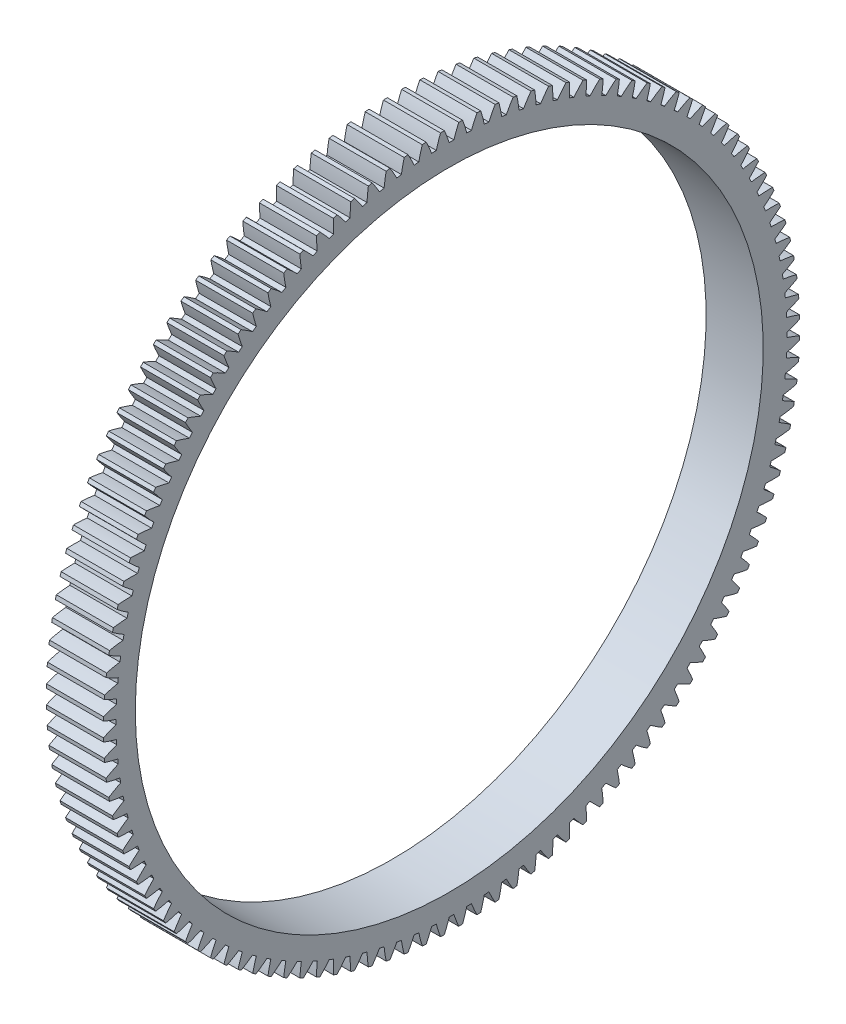
from build123d import *

# Parameters (mm, degrees)
BASPROSKE_W        = 12
BASPROSKE_H        = 61
TOOTHCUT_DEPTH     = 88.097646352
TEETHCUTS_COUNT    = 120
TEETHCUTS_ANGLE    = 357
BORSKE_R           = 0.4
BORE_DEPTH         = 50.0000508
SKETCH1_R          = 55
CUT_EXTRUDE1_DEPTH = 10
CUT_EXTRUDE2_DEPTH = 2


with BuildPart() as part:
    # BasProSke → Base-Revolve (revolve)
    with BuildSketch(Plane(origin=(0, 0, 0), x_dir=(1, 0, 0), z_dir=(0, 1, 0)), mode=Mode.PRIVATE) as base_revolve_sk:
        with Locations((6, 30.5)):
            Rectangle(BASPROSKE_W, BASPROSKE_H)
    revolve(base_revolve_sk.sketch.rotate(Axis((-10, 0, 0), (1, 0, 0)), 180), axis=Axis((-10, 0, 0), (1, 0, 0)))

    # TooCutSke → ToothCut (cut, through all)
    with BuildSketch(Plane(origin=(0, 0, 0), x_dir=(0, 0, -1), z_dir=(1, 0, 0))):
        with BuildLine():
            ThreePointArc((0.410713273, 58.747564338), (0, 58.749), (-0.410713273, 58.747564338))
            ThreePointArc((-0.410713273, 58.747564338), (-0.812377908, 59.890725701), (-1.271226346, 61.01215804))
            ThreePointArc((-1.271226346, 61.01215804), (0, 61.0254), (1.271226346, 61.01215804))
            ThreePointArc((1.271226346, 61.01215804), (0.812377908, 59.890725701), (0.410713273, 58.747564338))
        make_face()
    toothcut = extrude(amount=TOOTHCUT_DEPTH, mode=Mode.SUBTRACT)

    # TeethCuts: ToothCut ×120 about axis
    teethcuts_axis = Axis((-10, 0, 0), (1, 0, 0))
    for i in range(1, TEETHCUTS_COUNT):
        add(toothcut.rotate(teethcuts_axis, i * TEETHCUTS_ANGLE / (TEETHCUTS_COUNT - 1)), mode=Mode.SUBTRACT)

    # BorSke → Bore (cut, symmetric)
    with BuildSketch(Plane(origin=(0, 0, 0), x_dir=(0, 0, -1), z_dir=(1, 0, 0))):
        with Locations(Location((0, 0, 0), (0, 0, 180))):
            Circle(BORSKE_R)
    extrude(amount=BORE_DEPTH, both=True, mode=Mode.SUBTRACT)

    # Sketch1 → Cut-Extrude1 (cut)
    with BuildSketch(Plane.ZY):
        with Locations((0.4, 0)):
            Circle(SKETCH1_R)
    extrude(amount=-CUT_EXTRUDE1_DEPTH, mode=Mode.SUBTRACT)

    # Sketch2 → Cut-Extrude2 (cut)
    with BuildSketch(Plane(origin=(12, 0, 0), x_dir=(0, 0, -1), z_dir=(1, 0, 0))):
        with BuildLine():
            ThreePointArc((-60.986981523, 1.260192324), (-59.877876436, 0.807499581), (-58.747564338, 0.410713273))
            ThreePointArc((-58.747564338, 0.410713273), (-58.749, 0), (-58.747564338, -0.410713273))
            ThreePointArc((-58.747564338, -0.410713273), (-59.877876436, -0.807499581), (-60.986981523, -1.260192324))
            ThreePointArc((-60.986981523, -1.260192324), (-60.979096824, -1.596793847), (-60.969354355, -1.933346722))
            ThreePointArc((-60.969354355, -1.933346722), (-59.83807715, -2.32737299), (-58.688547914, -2.664459552))
            ThreePointArc((-58.688547914, -2.664459552), (-58.668486537, -3.074685093), (-58.645557771, -3.484760361))
            ThreePointArc((-58.645557771, -3.484760361), (-59.753554624, -3.940158852), (-60.837447614, -4.450277271))
            ThreePointArc((-60.837447614, -4.450277271), (-60.811957358, -4.786004839), (-60.784614424, -5.121586599))
            ThreePointArc((-60.784614424, -5.121586599), (-59.634265854, -5.455866393), (-58.468670261, -5.732329279))
            ThreePointArc((-58.468670261, -5.732329279), (-58.427166831, -6.140942689), (-58.382807806, -6.549255963))
            ThreePointArc((-58.382807806, -6.549255963), (-59.465452473, -7.062018422), (-60.52116249, -7.628164317))
            ThreePointArc((-60.52116249, -7.628164317), (-60.478136544, -7.962097725), (-60.433268091, -8.295788563))
            ThreePointArc((-60.433268091, -8.295788563), (-59.26700118, -8.569405646), (-58.088534046, -8.784487089))
            ThreePointArc((-58.088534046, -8.784487089), (-58.025702322, -9.190368387), (-57.960034624, -9.59580051))
            ThreePointArc((-57.960034624, -9.59580051), (-59.01435965, -10.16452149), (-60.038993066, -10.785143095))
            ThreePointArc((-60.038993066, -10.785143095), (-59.978549361, -11.116367055), (-59.91627837, -11.447252348))
            ThreePointArc((-59.91627837, -11.447252348), (-58.737289776, -11.659456754), (-57.549181197, -11.812567231))
            ThreePointArc((-57.549181197, -11.812567231), (-57.465193396, -12.214603924), (-57.378397015, -12.616043635))
            ThreePointArc((-57.378397015, -12.616043635), (-58.401512569, -13.239164311), (-59.392260936, -13.912560545))
            ThreePointArc((-59.392260936, -13.912560545), (-59.314565144, -14.240167195), (-59.235062295, -14.567340009))
            ThreePointArc((-59.235062295, -14.567340009), (-58.046583543, -14.717550101), (-56.852090042, -14.808269947))
            ThreePointArc((-56.852090042, -14.808269947), (-56.747176369, -15.205360081), (-56.639489208, -15.601707061))
            ThreePointArc((-56.639489208, -15.601707061), (-57.628591002, -16.277519502), (-58.582738747, -17.001844634))
            ThreePointArc((-58.582738747, -17.001844634), (-58.488003827, -17.324936027), (-58.391487031, -17.647499604))
            ThreePointArc((-58.391487031, -17.647499604), (-57.19677566, -17.735303667), (-55.999171261, -17.763384224))
            ThreePointArc((-55.999171261, -17.763384224), (-55.873619276, -18.154439403), (-55.745336499, -18.544607293))
            ThreePointArc((-55.745336499, -18.544607293), (-56.697713473, -19.271259145), (-57.612645342, -20.044527848))
            ThreePointArc((-57.612645342, -20.044527848), (-57.501130957, -20.362218413), (-57.387864761, -20.67928863))
            ThreePointArc((-57.387864761, -20.67928863), (-56.19019539, -20.704445998), (-54.992762643, -20.6698103))
            ThreePointArc((-54.992762643, -20.6698103), (-54.846916476, -21.053758668), (-54.698389697, -21.436678045))
            ThreePointArc((-54.698389697, -21.436678045), (-55.611431451, -22.212177605), (-56.484639682, -23.032270405))
            ThreePointArc((-56.484639682, -23.032270405), (-56.356651483, -23.343689374), (-56.226946341, -23.654397162))
            ThreePointArc((-56.226946341, -23.654397162), (-55.0296017, -23.616838881), (-53.835622686, -23.519581863))
            ThreePointArc((-53.835622686, -23.519581863), (-53.669882091, -23.895371044), (-53.50151841, -24.269992352))
            ThreePointArc((-53.50151841, -24.269992352), (-54.372722362, -25.092214031), (-55.20181355, -25.95688311))
            ThreePointArc((-55.20181355, -25.95688311), (-55.057702345, -26.261176905), (-54.911913771, -26.564670636))
            ThreePointArc((-54.911913771, -26.564670636), (-53.718175697, -26.464499651), (-52.530923029, -26.304887887))
            ThreePointArc((-52.530923029, -26.304887887), (-52.34574229, -26.671487869), (-52.158003181, -27.036784298))
            ThreePointArc((-52.158003181, -27.036784298), (-52.98498142, -27.903474442), (-53.767683085, -28.810349802))
            ThreePointArc((-53.767683085, -28.810349802), (-53.607843872, -29.106684376), (-53.446371461, -29.402132195))
            ThreePointArc((-53.446371461, -29.402132195), (-52.259511909, -29.239623067), (-51.082239763, -29.018094041))
            ThreePointArc((-51.082239763, -29.018094041), (-50.878126447, -29.3745), (-50.671526491, -29.729470297))
            ThreePointArc((-50.671526491, -29.729470297), (-51.452012327, -30.638253369), (-52.186179137, -31.584849328))
            ThreePointArc((-52.186179137, -31.584849328), (-52.011050026, -31.872412448), (-51.834336363, -32.159004553))
            ThreePointArc((-51.834336363, -32.159004553), (-50.657608431, -31.934602708), (-49.493543629, -31.651763617))
            ThreePointArc((-49.493543629, -31.651763617), (-49.271057196, -31.996998668), (-49.046162668, -32.340669884))
            ThreePointArc((-49.046162668, -32.340669884), (-49.778016845, -33.289054973), (-50.4616365, -34.272776978))
            ThreePointArc((-50.4616365, -34.272776978), (-50.271697506, -34.550780452), (-50.080226951, -34.827731314))
            ThreePointArc((-50.080226951, -34.827731314), (-48.916855969, -34.542051823), (-47.769189132, -34.198677908))
            ThreePointArc((-47.769189132, -34.198677908), (-47.528939403, -34.531795787), (-47.286366723, -34.863225943))
            ThreePointArc((-47.286366723, -34.863225943), (-47.967583279, -35.848613592), (-48.598782024, -36.866765328))
            ThreePointArc((-48.598782024, -36.866765328), (-48.394553758, -37.13444717), (-48.188851119, -37.400997685))
            ThreePointArc((-48.188851119, -37.400997685), (-47.042025805, -37.054823575), (-45.913902608, -36.651856001))
            ThreePointArc((-45.913902608, -36.651856001), (-45.65654809, -36.971943654), (-45.396962133, -37.290224323))
            ThreePointArc((-45.396962133, -37.290224323), (-46.0256739, -38.309913652), (-46.602721666, -39.359704437))
            ThreePointArc((-46.602721666, -39.359704437), (-46.384763902, -39.616330948), (-46.165392995, -39.871750522))
            ThreePointArc((-46.165392995, -39.871750522), (-45.038256718, -39.466030632), (-43.932769268, -39.004573904))
            ThreePointArc((-43.932769268, -39.004573904), (-43.659015352, -39.310753993), (-43.383127626, -39.615012791))
            ThreePointArc((-43.383127626, -39.615012791), (-43.957611349, -40.666208903), (-44.478926486, -41.744761332))
            ThreePointArc((-44.478926486, -41.744761332), (-44.247836632, -41.989629117), (-44.015398737, -42.233217661))
            ThreePointArc((-44.015398737, -42.233217661), (-42.911040901, -41.769064041), (-41.831219262, -41.250382981))
            ThreePointArc((-41.831219262, -41.250382981), (-41.541816288, -41.541816288), (-41.250382981, -41.831219262))
            ThreePointArc((-41.250382981, -41.831219262), (-41.769064041, -42.911040901), (-42.233217661, -44.015398737))
            ThreePointArc((-42.233217661, -44.015398737), (-41.989629117, -44.247836632), (-41.744761332, -44.478926486))
            ThreePointArc((-41.744761332, -44.478926486), (-40.666208903, -43.957611349), (-39.615012791, -43.383127626))
            ThreePointArc((-39.615012791, -43.383127626), (-39.310753993, -43.659015352), (-39.004573904, -43.932769268))
            ThreePointArc((-39.004573904, -43.932769268), (-39.466030632, -45.038256718), (-39.871750522, -46.165392995))
            ThreePointArc((-39.871750522, -46.165392995), (-39.616330948, -46.384763902), (-39.359704437, -46.602721666))
            ThreePointArc((-39.359704437, -46.602721666), (-38.309913652, -46.0256739), (-37.290224323, -45.396962133))
            ThreePointArc((-37.290224323, -45.396962133), (-36.971943654, -45.65654809), (-36.651856001, -45.913902608))
            ThreePointArc((-36.651856001, -45.913902608), (-37.054823575, -47.042025805), (-37.400997685, -48.188851119))
            ThreePointArc((-37.400997685, -48.188851119), (-37.13444717, -48.394553758), (-36.866765328, -48.598782024))
            ThreePointArc((-36.866765328, -48.598782024), (-35.848613592, -47.967583279), (-34.863225943, -47.286366723))
            ThreePointArc((-34.863225943, -47.286366723), (-34.531795787, -47.528939403), (-34.198677908, -47.769189132))
            ThreePointArc((-34.198677908, -47.769189132), (-34.542051823, -48.916855969), (-34.827731314, -50.080226951))
            ThreePointArc((-34.827731314, -50.080226951), (-34.550780452, -50.271697506), (-34.272776978, -50.4616365))
            ThreePointArc((-34.272776978, -50.4616365), (-33.289054973, -49.778016845), (-32.340669884, -49.046162668))
            ThreePointArc((-32.340669884, -49.046162668), (-31.996998668, -49.271057196), (-31.651763617, -49.493543629))
            ThreePointArc((-31.651763617, -49.493543629), (-31.934602708, -50.657608431), (-32.159004553, -51.834336363))
            ThreePointArc((-32.159004553, -51.834336363), (-31.872412448, -52.011050026), (-31.584849328, -52.186179137))
            ThreePointArc((-31.584849328, -52.186179137), (-30.638253369, -51.452012327), (-29.729470297, -50.671526491))
            ThreePointArc((-29.729470297, -50.671526491), (-29.3745, -50.878126447), (-29.018094041, -51.082239763))
            ThreePointArc((-29.018094041, -51.082239763), (-29.239623067, -52.259511909), (-29.402132195, -53.446371461))
            ThreePointArc((-29.402132195, -53.446371461), (-29.106684376, -53.607843872), (-28.810349802, -53.767683085))
            ThreePointArc((-28.810349802, -53.767683085), (-27.903474442, -52.98498142), (-27.036784298, -52.158003181))
            ThreePointArc((-27.036784298, -52.158003181), (-26.671487869, -52.34574229), (-26.304887887, -52.530923029))
            ThreePointArc((-26.304887887, -52.530923029), (-26.464499651, -53.718175697), (-26.564670636, -54.911913771))
            ThreePointArc((-26.564670636, -54.911913771), (-26.261176905, -55.057702345), (-25.95688311, -55.20181355))
            ThreePointArc((-25.95688311, -55.20181355), (-25.092214031, -54.372722362), (-24.269992352, -53.50151841))
            ThreePointArc((-24.269992352, -53.50151841), (-23.895371044, -53.669882091), (-23.519581863, -53.835622686))
            ThreePointArc((-23.519581863, -53.835622686), (-23.616838881, -55.0296017), (-23.654397162, -56.226946341))
            ThreePointArc((-23.654397162, -56.226946341), (-23.343689374, -56.356651483), (-23.032270405, -56.484639682))
            ThreePointArc((-23.032270405, -56.484639682), (-22.212177605, -55.611431451), (-21.436678045, -54.698389697))
            ThreePointArc((-21.436678045, -54.698389697), (-21.053758668, -54.846916476), (-20.6698103, -54.992762643))
            ThreePointArc((-20.6698103, -54.992762643), (-20.704445998, -56.19019539), (-20.67928863, -57.387864761))
            ThreePointArc((-20.67928863, -57.387864761), (-20.362218413, -57.501130957), (-20.044527848, -57.612645342))
            ThreePointArc((-20.044527848, -57.612645342), (-19.271259145, -56.697713473), (-18.544607293, -55.745336499))
            ThreePointArc((-18.544607293, -55.745336499), (-18.154439403, -55.873619276), (-17.763384224, -55.999171261))
            ThreePointArc((-17.763384224, -55.999171261), (-17.735303667, -57.19677566), (-17.647499604, -58.391487031))
            ThreePointArc((-17.647499604, -58.391487031), (-17.324936027, -58.488003827), (-17.001844634, -58.582738747))
            ThreePointArc((-17.001844634, -58.582738747), (-16.277519502, -57.628591002), (-15.601707061, -56.639489208))
            ThreePointArc((-15.601707061, -56.639489208), (-15.205360081, -56.747176369), (-14.808269947, -56.852090042))
            ThreePointArc((-14.808269947, -56.852090042), (-14.717550101, -58.046583543), (-14.567340009, -59.235062295))
            ThreePointArc((-14.567340009, -59.235062295), (-14.240167195, -59.314565144), (-13.912560545, -59.392260936))
            ThreePointArc((-13.912560545, -59.392260936), (-13.239164311, -58.401512569), (-12.616043635, -57.378397015))
            ThreePointArc((-12.616043635, -57.378397015), (-12.214603924, -57.465193396), (-11.812567231, -57.549181197))
            ThreePointArc((-11.812567231, -57.549181197), (-11.659456754, -58.737289776), (-11.447252348, -59.91627837))
            ThreePointArc((-11.447252348, -59.91627837), (-11.116367055, -59.978549361), (-10.785143095, -60.038993066))
            ThreePointArc((-10.785143095, -60.038993066), (-10.16452149, -59.01435965), (-9.59580051, -57.960034624))
            ThreePointArc((-9.59580051, -57.960034624), (-9.190368387, -58.025702322), (-8.784487089, -58.088534046))
            ThreePointArc((-8.784487089, -58.088534046), (-8.569405646, -59.26700118), (-8.295788563, -60.433268091))
            ThreePointArc((-8.295788563, -60.433268091), (-7.962097725, -60.478136544), (-7.628164317, -60.52116249))
            ThreePointArc((-7.628164317, -60.52116249), (-7.062018422, -59.465452473), (-6.549255963, -58.382807806))
            ThreePointArc((-6.549255963, -58.382807806), (-6.140942689, -58.427166831), (-5.732329279, -58.468670261))
            ThreePointArc((-5.732329279, -58.468670261), (-5.455866393, -59.634265854), (-5.121586599, -60.784614424))
            ThreePointArc((-5.121586599, -60.784614424), (-4.786004839, -60.811957358), (-4.450277271, -60.837447614))
            ThreePointArc((-4.450277271, -60.837447614), (-3.940158852, -59.753554624), (-3.484760361, -58.645557771))
            ThreePointArc((-3.484760361, -58.645557771), (-3.074685093, -58.668486537), (-2.664459552, -58.688547914))
            ThreePointArc((-2.664459552, -58.688547914), (-2.32737299, -59.83807715), (-1.933346722, -60.969354355))
            ThreePointArc((-1.933346722, -60.969354355), (-1.596793847, -60.979096824), (-1.260192324, -60.986981523))
            ThreePointArc((-1.260192324, -60.986981523), (-0.807499581, -59.877876436), (-0.410713273, -58.747564338))
            ThreePointArc((-0.410713273, -58.747564338), (0, -58.749), (0.410713273, -58.747564338))
            ThreePointArc((0.410713273, -58.747564338), (0.807499581, -59.877876436), (1.260192324, -60.986981523))
            ThreePointArc((1.260192324, -60.986981523), (1.596793847, -60.979096824), (1.933346722, -60.969354355))
            ThreePointArc((1.933346722, -60.969354355), (2.32737299, -59.83807715), (2.664459552, -58.688547914))
            ThreePointArc((2.664459552, -58.688547914), (3.074685093, -58.668486537), (3.484760361, -58.645557771))
            ThreePointArc((3.484760361, -58.645557771), (3.940158852, -59.753554624), (4.450277271, -60.837447614))
            ThreePointArc((4.450277271, -60.837447614), (4.786004839, -60.811957358), (5.121586599, -60.784614424))
            ThreePointArc((5.121586599, -60.784614424), (5.455866393, -59.634265854), (5.732329279, -58.468670261))
            ThreePointArc((5.732329279, -58.468670261), (6.140942689, -58.427166831), (6.549255963, -58.382807806))
            ThreePointArc((6.549255963, -58.382807806), (7.062018422, -59.465452473), (7.628164317, -60.52116249))
            ThreePointArc((7.628164317, -60.52116249), (7.962097725, -60.478136544), (8.295788563, -60.433268091))
            ThreePointArc((8.295788563, -60.433268091), (8.569405646, -59.26700118), (8.784487089, -58.088534046))
            ThreePointArc((8.784487089, -58.088534046), (9.190368387, -58.025702322), (9.59580051, -57.960034624))
            ThreePointArc((9.59580051, -57.960034624), (10.16452149, -59.01435965), (10.785143095, -60.038993066))
            ThreePointArc((10.785143095, -60.038993066), (11.116367055, -59.978549361), (11.447252348, -59.91627837))
            ThreePointArc((11.447252348, -59.91627837), (11.659456754, -58.737289776), (11.812567231, -57.549181197))
            ThreePointArc((11.812567231, -57.549181197), (12.214603924, -57.465193396), (12.616043635, -57.378397015))
            ThreePointArc((12.616043635, -57.378397015), (13.239164311, -58.401512569), (13.912560545, -59.392260936))
            ThreePointArc((13.912560545, -59.392260936), (14.240167195, -59.314565144), (14.567340009, -59.235062295))
            ThreePointArc((14.567340009, -59.235062295), (14.717550101, -58.046583543), (14.808269947, -56.852090042))
            ThreePointArc((14.808269947, -56.852090042), (15.205360081, -56.747176369), (15.601707061, -56.639489208))
            ThreePointArc((15.601707061, -56.639489208), (16.277519502, -57.628591002), (17.001844634, -58.582738747))
            ThreePointArc((17.001844634, -58.582738747), (17.324936027, -58.488003827), (17.647499604, -58.391487031))
            ThreePointArc((17.647499604, -58.391487031), (17.735303667, -57.19677566), (17.763384224, -55.999171261))
            ThreePointArc((17.763384224, -55.999171261), (18.154439403, -55.873619276), (18.544607293, -55.745336499))
            ThreePointArc((18.544607293, -55.745336499), (19.271259145, -56.697713473), (20.044527848, -57.612645342))
            ThreePointArc((20.044527848, -57.612645342), (20.362218413, -57.501130957), (20.67928863, -57.387864761))
            ThreePointArc((20.67928863, -57.387864761), (20.704445998, -56.19019539), (20.6698103, -54.992762643))
            ThreePointArc((20.6698103, -54.992762643), (21.053758668, -54.846916476), (21.436678045, -54.698389697))
            ThreePointArc((21.436678045, -54.698389697), (22.212177605, -55.611431451), (23.032270405, -56.484639682))
            ThreePointArc((23.032270405, -56.484639682), (23.343689374, -56.356651483), (23.654397162, -56.226946341))
            ThreePointArc((23.654397162, -56.226946341), (23.616838881, -55.0296017), (23.519581863, -53.835622686))
            ThreePointArc((23.519581863, -53.835622686), (23.895371044, -53.669882091), (24.269992352, -53.50151841))
            ThreePointArc((24.269992352, -53.50151841), (25.092214031, -54.372722362), (25.95688311, -55.20181355))
            ThreePointArc((25.95688311, -55.20181355), (26.261176905, -55.057702345), (26.564670636, -54.911913771))
            ThreePointArc((26.564670636, -54.911913771), (26.464499651, -53.718175697), (26.304887887, -52.530923029))
            ThreePointArc((26.304887887, -52.530923029), (26.671487869, -52.34574229), (27.036784298, -52.158003181))
            ThreePointArc((27.036784298, -52.158003181), (27.903474442, -52.98498142), (28.810349802, -53.767683085))
            ThreePointArc((28.810349802, -53.767683085), (29.106684376, -53.607843872), (29.402132195, -53.446371461))
            ThreePointArc((29.402132195, -53.446371461), (29.239623067, -52.259511909), (29.018094041, -51.082239763))
            ThreePointArc((29.018094041, -51.082239763), (29.3745, -50.878126447), (29.729470297, -50.671526491))
            ThreePointArc((29.729470297, -50.671526491), (30.638253369, -51.452012327), (31.584849328, -52.186179137))
            ThreePointArc((31.584849328, -52.186179137), (31.872412448, -52.011050026), (32.159004553, -51.834336363))
            ThreePointArc((32.159004553, -51.834336363), (31.934602708, -50.657608431), (31.651763617, -49.493543629))
            ThreePointArc((31.651763617, -49.493543629), (31.996998668, -49.271057196), (32.340669884, -49.046162668))
            ThreePointArc((32.340669884, -49.046162668), (33.289054973, -49.778016845), (34.272776978, -50.4616365))
            ThreePointArc((34.272776978, -50.4616365), (34.550780452, -50.271697506), (34.827731314, -50.080226951))
            ThreePointArc((34.827731314, -50.080226951), (34.542051823, -48.916855969), (34.198677908, -47.769189132))
            ThreePointArc((34.198677908, -47.769189132), (34.531795787, -47.528939403), (34.863225943, -47.286366723))
            ThreePointArc((34.863225943, -47.286366723), (35.848613592, -47.967583279), (36.866765328, -48.598782024))
            ThreePointArc((36.866765328, -48.598782024), (37.13444717, -48.394553758), (37.400997685, -48.188851119))
            ThreePointArc((37.400997685, -48.188851119), (37.054823575, -47.042025805), (36.651856001, -45.913902608))
            ThreePointArc((36.651856001, -45.913902608), (36.971943654, -45.65654809), (37.290224323, -45.396962133))
            ThreePointArc((37.290224323, -45.396962133), (38.309913652, -46.0256739), (39.359704437, -46.602721666))
            ThreePointArc((39.359704437, -46.602721666), (39.616330948, -46.384763902), (39.871750522, -46.165392995))
            ThreePointArc((39.871750522, -46.165392995), (39.466030632, -45.038256718), (39.004573904, -43.932769268))
            ThreePointArc((39.004573904, -43.932769268), (39.310753993, -43.659015352), (39.615012791, -43.383127626))
            ThreePointArc((39.615012791, -43.383127626), (40.666208903, -43.957611349), (41.744761332, -44.478926486))
            ThreePointArc((41.744761332, -44.478926486), (41.989629117, -44.247836632), (42.233217661, -44.015398737))
            ThreePointArc((42.233217661, -44.015398737), (41.769064041, -42.911040901), (41.250382981, -41.831219262))
            ThreePointArc((41.250382981, -41.831219262), (41.541816288, -41.541816288), (41.831219262, -41.250382981))
            ThreePointArc((41.831219262, -41.250382981), (42.911040901, -41.769064041), (44.015398737, -42.233217661))
            ThreePointArc((44.015398737, -42.233217661), (44.247836632, -41.989629117), (44.478926486, -41.744761332))
            ThreePointArc((44.478926486, -41.744761332), (43.957611349, -40.666208903), (43.383127626, -39.615012791))
            ThreePointArc((43.383127626, -39.615012791), (43.659015352, -39.310753993), (43.932769268, -39.004573904))
            ThreePointArc((43.932769268, -39.004573904), (45.038256718, -39.466030632), (46.165392995, -39.871750522))
            ThreePointArc((46.165392995, -39.871750522), (46.384763902, -39.616330948), (46.602721666, -39.359704437))
            ThreePointArc((46.602721666, -39.359704437), (46.0256739, -38.309913652), (45.396962133, -37.290224323))
            ThreePointArc((45.396962133, -37.290224323), (45.65654809, -36.971943654), (45.913902608, -36.651856001))
            ThreePointArc((45.913902608, -36.651856001), (47.042025805, -37.054823575), (48.188851119, -37.400997685))
            ThreePointArc((48.188851119, -37.400997685), (48.394553758, -37.13444717), (48.598782024, -36.866765328))
            ThreePointArc((48.598782024, -36.866765328), (47.967583279, -35.848613592), (47.286366723, -34.863225943))
            ThreePointArc((47.286366723, -34.863225943), (47.528939403, -34.531795787), (47.769189132, -34.198677908))
            ThreePointArc((47.769189132, -34.198677908), (48.916855969, -34.542051823), (50.080226951, -34.827731314))
            ThreePointArc((50.080226951, -34.827731314), (50.271697506, -34.550780452), (50.4616365, -34.272776978))
            ThreePointArc((50.4616365, -34.272776978), (49.778016845, -33.289054973), (49.046162668, -32.340669884))
            ThreePointArc((49.046162668, -32.340669884), (49.271057196, -31.996998668), (49.493543629, -31.651763617))
            ThreePointArc((49.493543629, -31.651763617), (50.657608431, -31.934602708), (51.834336363, -32.159004553))
            ThreePointArc((51.834336363, -32.159004553), (52.011050026, -31.872412448), (52.186179137, -31.584849328))
            ThreePointArc((52.186179137, -31.584849328), (51.452012327, -30.638253369), (50.671526491, -29.729470297))
            ThreePointArc((50.671526491, -29.729470297), (50.878126447, -29.3745), (51.082239763, -29.018094041))
            ThreePointArc((51.082239763, -29.018094041), (52.259511909, -29.239623067), (53.446371461, -29.402132195))
            ThreePointArc((53.446371461, -29.402132195), (53.607843872, -29.106684376), (53.767683085, -28.810349802))
            ThreePointArc((53.767683085, -28.810349802), (52.98498142, -27.903474442), (52.158003181, -27.036784298))
            ThreePointArc((52.158003181, -27.036784298), (52.34574229, -26.671487869), (52.530923029, -26.304887887))
            ThreePointArc((52.530923029, -26.304887887), (53.718175697, -26.464499651), (54.911913771, -26.564670636))
            ThreePointArc((54.911913771, -26.564670636), (55.057702345, -26.261176905), (55.20181355, -25.95688311))
            ThreePointArc((55.20181355, -25.95688311), (54.372722362, -25.092214031), (53.50151841, -24.269992352))
            ThreePointArc((53.50151841, -24.269992352), (53.669882091, -23.895371044), (53.835622686, -23.519581863))
            ThreePointArc((53.835622686, -23.519581863), (55.0296017, -23.616838881), (56.226946341, -23.654397162))
            ThreePointArc((56.226946341, -23.654397162), (56.356651483, -23.343689374), (56.484639682, -23.032270405))
            ThreePointArc((56.484639682, -23.032270405), (55.611431451, -22.212177605), (54.698389697, -21.436678045))
            ThreePointArc((54.698389697, -21.436678045), (54.846916476, -21.053758668), (54.992762643, -20.6698103))
            ThreePointArc((54.992762643, -20.6698103), (56.19019539, -20.704445998), (57.387864761, -20.67928863))
            ThreePointArc((57.387864761, -20.67928863), (57.501130957, -20.362218413), (57.612645342, -20.044527848))
            ThreePointArc((57.612645342, -20.044527848), (56.697713473, -19.271259145), (55.745336499, -18.544607293))
            ThreePointArc((55.745336499, -18.544607293), (55.873619276, -18.154439403), (55.999171261, -17.763384224))
            ThreePointArc((55.999171261, -17.763384224), (57.19677566, -17.735303667), (58.391487031, -17.647499604))
            ThreePointArc((58.391487031, -17.647499604), (58.488003827, -17.324936027), (58.582738747, -17.001844634))
            ThreePointArc((58.582738747, -17.001844634), (57.628591002, -16.277519502), (56.639489208, -15.601707061))
            ThreePointArc((56.639489208, -15.601707061), (56.747176369, -15.205360081), (56.852090042, -14.808269947))
            ThreePointArc((56.852090042, -14.808269947), (58.046583543, -14.717550101), (59.235062295, -14.567340009))
            ThreePointArc((59.235062295, -14.567340009), (59.314565144, -14.240167195), (59.392260936, -13.912560545))
            ThreePointArc((59.392260936, -13.912560545), (58.401512569, -13.239164311), (57.378397015, -12.616043635))
            ThreePointArc((57.378397015, -12.616043635), (57.465193396, -12.214603924), (57.549181197, -11.812567231))
            ThreePointArc((57.549181197, -11.812567231), (58.737289776, -11.659456754), (59.91627837, -11.447252348))
            ThreePointArc((59.91627837, -11.447252348), (59.978549361, -11.116367055), (60.038993066, -10.785143095))
            ThreePointArc((60.038993066, -10.785143095), (59.01435965, -10.16452149), (57.960034624, -9.59580051))
            ThreePointArc((57.960034624, -9.59580051), (58.025702322, -9.190368387), (58.088534046, -8.784487089))
            ThreePointArc((58.088534046, -8.784487089), (59.26700118, -8.569405646), (60.433268091, -8.295788563))
            ThreePointArc((60.433268091, -8.295788563), (60.478136544, -7.962097725), (60.52116249, -7.628164317))
            ThreePointArc((60.52116249, -7.628164317), (59.465452473, -7.062018422), (58.382807806, -6.549255963))
            ThreePointArc((58.382807806, -6.549255963), (58.427166831, -6.140942689), (58.468670261, -5.732329279))
            ThreePointArc((58.468670261, -5.732329279), (59.634265854, -5.455866393), (60.784614424, -5.121586599))
            ThreePointArc((60.784614424, -5.121586599), (60.811957358, -4.786004839), (60.837447614, -4.450277271))
            ThreePointArc((60.837447614, -4.450277271), (59.753554624, -3.940158852), (58.645557771, -3.484760361))
            ThreePointArc((58.645557771, -3.484760361), (58.668486537, -3.074685093), (58.688547914, -2.664459552))
            ThreePointArc((58.688547914, -2.664459552), (59.83807715, -2.32737299), (60.969354355, -1.933346722))
            ThreePointArc((60.969354355, -1.933346722), (60.979096824, -1.596793847), (60.986981523, -1.260192324))
            ThreePointArc((60.986981523, -1.260192324), (59.877876436, -0.807499581), (58.747564338, -0.410713273))
            ThreePointArc((58.747564338, -0.410713273), (58.749, 0), (58.747564338, 0.410713273))
            ThreePointArc((58.747564338, 0.410713273), (59.877876436, 0.807499581), (60.986981523, 1.260192324))
            ThreePointArc((60.986981523, 1.260192324), (60.979096824, 1.596793847), (60.969354355, 1.933346722))
            ThreePointArc((60.969354355, 1.933346722), (59.83807715, 2.32737299), (58.688547914, 2.664459552))
            ThreePointArc((58.688547914, 2.664459552), (58.668486537, 3.074685093), (58.645557771, 3.484760361))
            ThreePointArc((58.645557771, 3.484760361), (59.753554624, 3.940158852), (60.837447614, 4.450277271))
            ThreePointArc((60.837447614, 4.450277271), (60.811957358, 4.786004839), (60.784614424, 5.121586599))
            ThreePointArc((60.784614424, 5.121586599), (59.634265854, 5.455866393), (58.468670261, 5.732329279))
            ThreePointArc((58.468670261, 5.732329279), (58.427166831, 6.140942689), (58.382807806, 6.549255963))
            ThreePointArc((58.382807806, 6.549255963), (59.465452473, 7.062018422), (60.52116249, 7.628164317))
            ThreePointArc((60.52116249, 7.628164317), (60.478136544, 7.962097725), (60.433268091, 8.295788563))
            ThreePointArc((60.433268091, 8.295788563), (59.26700118, 8.569405646), (58.088534046, 8.784487089))
            ThreePointArc((58.088534046, 8.784487089), (58.025702322, 9.190368387), (57.960034624, 9.59580051))
            ThreePointArc((57.960034624, 9.59580051), (59.01435965, 10.16452149), (60.038993066, 10.785143095))
            ThreePointArc((60.038993066, 10.785143095), (59.978549361, 11.116367055), (59.91627837, 11.447252348))
            ThreePointArc((59.91627837, 11.447252348), (58.737289776, 11.659456754), (57.549181197, 11.812567231))
            ThreePointArc((57.549181197, 11.812567231), (57.465193396, 12.214603924), (57.378397015, 12.616043635))
            ThreePointArc((57.378397015, 12.616043635), (58.401512569, 13.239164311), (59.392260936, 13.912560545))
            ThreePointArc((59.392260936, 13.912560545), (59.314565144, 14.240167195), (59.235062295, 14.567340009))
            ThreePointArc((59.235062295, 14.567340009), (58.046583543, 14.717550101), (56.852090042, 14.808269947))
            ThreePointArc((56.852090042, 14.808269947), (56.747176369, 15.205360081), (56.639489208, 15.601707061))
            ThreePointArc((56.639489208, 15.601707061), (57.628591002, 16.277519502), (58.582738747, 17.001844634))
            ThreePointArc((58.582738747, 17.001844634), (58.488003827, 17.324936027), (58.391487031, 17.647499604))
            ThreePointArc((58.391487031, 17.647499604), (57.19677566, 17.735303667), (55.999171261, 17.763384224))
            ThreePointArc((55.999171261, 17.763384224), (55.873619276, 18.154439403), (55.745336499, 18.544607293))
            ThreePointArc((55.745336499, 18.544607293), (56.697713473, 19.271259145), (57.612645342, 20.044527848))
            ThreePointArc((57.612645342, 20.044527848), (57.501130957, 20.362218413), (57.387864761, 20.67928863))
            ThreePointArc((57.387864761, 20.67928863), (56.19019539, 20.704445998), (54.992762643, 20.6698103))
            ThreePointArc((54.992762643, 20.6698103), (54.846916476, 21.053758668), (54.698389697, 21.436678045))
            ThreePointArc((54.698389697, 21.436678045), (55.611431451, 22.212177605), (56.484639682, 23.032270405))
            ThreePointArc((56.484639682, 23.032270405), (56.356651483, 23.343689374), (56.226946341, 23.654397162))
            ThreePointArc((56.226946341, 23.654397162), (55.0296017, 23.616838881), (53.835622686, 23.519581863))
            ThreePointArc((53.835622686, 23.519581863), (53.669882091, 23.895371044), (53.50151841, 24.269992352))
            ThreePointArc((53.50151841, 24.269992352), (54.372722362, 25.092214031), (55.20181355, 25.95688311))
            ThreePointArc((55.20181355, 25.95688311), (55.057702345, 26.261176905), (54.911913771, 26.564670636))
            ThreePointArc((54.911913771, 26.564670636), (53.718175697, 26.464499651), (52.530923029, 26.304887887))
            ThreePointArc((52.530923029, 26.304887887), (52.34574229, 26.671487869), (52.158003181, 27.036784298))
            ThreePointArc((52.158003181, 27.036784298), (52.98498142, 27.903474442), (53.767683085, 28.810349802))
            ThreePointArc((53.767683085, 28.810349802), (53.607843872, 29.106684376), (53.446371461, 29.402132195))
            ThreePointArc((53.446371461, 29.402132195), (52.259511909, 29.239623067), (51.082239763, 29.018094041))
            ThreePointArc((51.082239763, 29.018094041), (50.878126447, 29.3745), (50.671526491, 29.729470297))
            ThreePointArc((50.671526491, 29.729470297), (51.452012327, 30.638253369), (52.186179137, 31.584849328))
            ThreePointArc((52.186179137, 31.584849328), (52.011050026, 31.872412448), (51.834336363, 32.159004553))
            ThreePointArc((51.834336363, 32.159004553), (50.657608431, 31.934602708), (49.493543629, 31.651763617))
            ThreePointArc((49.493543629, 31.651763617), (49.271057196, 31.996998668), (49.046162668, 32.340669884))
            ThreePointArc((49.046162668, 32.340669884), (49.778016845, 33.289054973), (50.4616365, 34.272776978))
            ThreePointArc((50.4616365, 34.272776978), (50.271697506, 34.550780452), (50.080226951, 34.827731314))
            ThreePointArc((50.080226951, 34.827731314), (48.916855969, 34.542051823), (47.769189132, 34.198677908))
            ThreePointArc((47.769189132, 34.198677908), (47.528939403, 34.531795787), (47.286366723, 34.863225943))
            ThreePointArc((47.286366723, 34.863225943), (47.967583279, 35.848613592), (48.598782024, 36.866765328))
            ThreePointArc((48.598782024, 36.866765328), (48.394553758, 37.13444717), (48.188851119, 37.400997685))
            ThreePointArc((48.188851119, 37.400997685), (47.042025805, 37.054823575), (45.913902608, 36.651856001))
            ThreePointArc((45.913902608, 36.651856001), (45.65654809, 36.971943654), (45.396962133, 37.290224323))
            ThreePointArc((45.396962133, 37.290224323), (46.0256739, 38.309913652), (46.602721666, 39.359704437))
            ThreePointArc((46.602721666, 39.359704437), (46.384763902, 39.616330948), (46.165392995, 39.871750522))
            ThreePointArc((46.165392995, 39.871750522), (45.038256718, 39.466030632), (43.932769268, 39.004573904))
            ThreePointArc((43.932769268, 39.004573904), (43.659015352, 39.310753993), (43.383127626, 39.615012791))
            ThreePointArc((43.383127626, 39.615012791), (43.957611349, 40.666208903), (44.478926486, 41.744761332))
            ThreePointArc((44.478926486, 41.744761332), (44.247836632, 41.989629117), (44.015398737, 42.233217661))
            ThreePointArc((44.015398737, 42.233217661), (42.911040901, 41.769064041), (41.831219262, 41.250382981))
            ThreePointArc((41.831219262, 41.250382981), (41.541816288, 41.541816288), (41.250382981, 41.831219262))
            ThreePointArc((41.250382981, 41.831219262), (41.769064041, 42.911040901), (42.233217661, 44.015398737))
            ThreePointArc((42.233217661, 44.015398737), (41.989629117, 44.247836632), (41.744761332, 44.478926486))
            ThreePointArc((41.744761332, 44.478926486), (40.666208903, 43.957611349), (39.615012791, 43.383127626))
            ThreePointArc((39.615012791, 43.383127626), (39.310753993, 43.659015352), (39.004573904, 43.932769268))
            ThreePointArc((39.004573904, 43.932769268), (39.466030632, 45.038256718), (39.871750522, 46.165392995))
            ThreePointArc((39.871750522, 46.165392995), (39.616330948, 46.384763902), (39.359704437, 46.602721666))
            ThreePointArc((39.359704437, 46.602721666), (38.309913652, 46.0256739), (37.290224323, 45.396962133))
            ThreePointArc((37.290224323, 45.396962133), (36.971943654, 45.65654809), (36.651856001, 45.913902608))
            ThreePointArc((36.651856001, 45.913902608), (37.054823575, 47.042025805), (37.400997685, 48.188851119))
            ThreePointArc((37.400997685, 48.188851119), (37.13444717, 48.394553758), (36.866765328, 48.598782024))
            ThreePointArc((36.866765328, 48.598782024), (35.848613592, 47.967583279), (34.863225943, 47.286366723))
            ThreePointArc((34.863225943, 47.286366723), (34.531795787, 47.528939403), (34.198677908, 47.769189132))
            ThreePointArc((34.198677908, 47.769189132), (34.542051823, 48.916855969), (34.827731314, 50.080226951))
            ThreePointArc((34.827731314, 50.080226951), (34.550780452, 50.271697506), (34.272776978, 50.4616365))
            ThreePointArc((34.272776978, 50.4616365), (33.289054973, 49.778016845), (32.340669884, 49.046162668))
            ThreePointArc((32.340669884, 49.046162668), (31.996998668, 49.271057196), (31.651763617, 49.493543629))
            ThreePointArc((31.651763617, 49.493543629), (31.934602708, 50.657608431), (32.159004553, 51.834336363))
            ThreePointArc((32.159004553, 51.834336363), (31.872412448, 52.011050026), (31.584849328, 52.186179137))
            ThreePointArc((31.584849328, 52.186179137), (30.638253369, 51.452012327), (29.729470297, 50.671526491))
            ThreePointArc((29.729470297, 50.671526491), (29.3745, 50.878126447), (29.018094041, 51.082239763))
            ThreePointArc((29.018094041, 51.082239763), (29.239623067, 52.259511909), (29.402132195, 53.446371461))
            ThreePointArc((29.402132195, 53.446371461), (29.106684376, 53.607843872), (28.810349802, 53.767683085))
            ThreePointArc((28.810349802, 53.767683085), (27.903474442, 52.98498142), (27.036784298, 52.158003181))
            ThreePointArc((27.036784298, 52.158003181), (26.671487869, 52.34574229), (26.304887887, 52.530923029))
            ThreePointArc((26.304887887, 52.530923029), (26.464499651, 53.718175697), (26.564670636, 54.911913771))
            ThreePointArc((26.564670636, 54.911913771), (26.261176905, 55.057702345), (25.95688311, 55.20181355))
            ThreePointArc((25.95688311, 55.20181355), (25.092214031, 54.372722362), (24.269992352, 53.50151841))
            ThreePointArc((24.269992352, 53.50151841), (23.895371044, 53.669882091), (23.519581863, 53.835622686))
            ThreePointArc((23.519581863, 53.835622686), (23.616838881, 55.0296017), (23.654397162, 56.226946341))
            ThreePointArc((23.654397162, 56.226946341), (23.343689374, 56.356651483), (23.032270405, 56.484639682))
            ThreePointArc((23.032270405, 56.484639682), (22.212177605, 55.611431451), (21.436678045, 54.698389697))
            ThreePointArc((21.436678045, 54.698389697), (21.053758668, 54.846916476), (20.6698103, 54.992762643))
            ThreePointArc((20.6698103, 54.992762643), (20.704445998, 56.19019539), (20.67928863, 57.387864761))
            ThreePointArc((20.67928863, 57.387864761), (20.362218413, 57.501130957), (20.044527848, 57.612645342))
            ThreePointArc((20.044527848, 57.612645342), (19.271259145, 56.697713473), (18.544607293, 55.745336499))
            ThreePointArc((18.544607293, 55.745336499), (18.154439403, 55.873619276), (17.763384224, 55.999171261))
            ThreePointArc((17.763384224, 55.999171261), (17.735303667, 57.19677566), (17.647499604, 58.391487031))
            ThreePointArc((17.647499604, 58.391487031), (17.324936027, 58.488003827), (17.001844634, 58.582738747))
            ThreePointArc((17.001844634, 58.582738747), (16.277519502, 57.628591002), (15.601707061, 56.639489208))
            ThreePointArc((15.601707061, 56.639489208), (15.205360081, 56.747176369), (14.808269947, 56.852090042))
            ThreePointArc((14.808269947, 56.852090042), (14.717550101, 58.046583543), (14.567340009, 59.235062295))
            ThreePointArc((14.567340009, 59.235062295), (14.240167195, 59.314565144), (13.912560545, 59.392260936))
            ThreePointArc((13.912560545, 59.392260936), (13.239164311, 58.401512569), (12.616043635, 57.378397015))
            ThreePointArc((12.616043635, 57.378397015), (12.214603924, 57.465193396), (11.812567231, 57.549181197))
            ThreePointArc((11.812567231, 57.549181197), (11.659456754, 58.737289776), (11.447252348, 59.91627837))
            ThreePointArc((11.447252348, 59.91627837), (11.116367055, 59.978549361), (10.785143095, 60.038993066))
            ThreePointArc((10.785143095, 60.038993066), (10.16452149, 59.01435965), (9.59580051, 57.960034624))
            ThreePointArc((9.59580051, 57.960034624), (9.190368387, 58.025702322), (8.784487089, 58.088534046))
            ThreePointArc((8.784487089, 58.088534046), (8.569405646, 59.26700118), (8.295788563, 60.433268091))
            ThreePointArc((8.295788563, 60.433268091), (7.962097725, 60.478136544), (7.628164317, 60.52116249))
            ThreePointArc((7.628164317, 60.52116249), (7.062018422, 59.465452473), (6.549255963, 58.382807806))
            ThreePointArc((6.549255963, 58.382807806), (6.140942689, 58.427166831), (5.732329279, 58.468670261))
            ThreePointArc((5.732329279, 58.468670261), (5.455866393, 59.634265854), (5.121586599, 60.784614424))
            ThreePointArc((5.121586599, 60.784614424), (4.786004839, 60.811957358), (4.450277271, 60.837447614))
            ThreePointArc((4.450277271, 60.837447614), (3.940158852, 59.753554624), (3.484760361, 58.645557771))
            ThreePointArc((3.484760361, 58.645557771), (3.074685093, 58.668486537), (2.664459552, 58.688547914))
            ThreePointArc((2.664459552, 58.688547914), (2.32737299, 59.83807715), (1.933346722, 60.969354355))
            ThreePointArc((1.933346722, 60.969354355), (1.596793847, 60.979096824), (1.260192324, 60.986981523))
            ThreePointArc((1.260192324, 60.986981523), (0.807499581, 59.877876436), (0.410713273, 58.747564338))
            ThreePointArc((0.410713273, 58.747564338), (0, 58.749), (-0.410713273, 58.747564338))
            ThreePointArc((-0.410713273, 58.747564338), (-0.807499581, 59.877876436), (-1.260192324, 60.986981523))
            ThreePointArc((-1.260192324, 60.986981523), (-1.596793847, 60.979096824), (-1.933346722, 60.969354355))
            ThreePointArc((-1.933346722, 60.969354355), (-2.32737299, 59.83807715), (-2.664459552, 58.688547914))
            ThreePointArc((-2.664459552, 58.688547914), (-3.074685093, 58.668486537), (-3.484760361, 58.645557771))
            ThreePointArc((-3.484760361, 58.645557771), (-3.940158852, 59.753554624), (-4.450277271, 60.837447614))
            ThreePointArc((-4.450277271, 60.837447614), (-4.786004839, 60.811957358), (-5.121586599, 60.784614424))
            ThreePointArc((-5.121586599, 60.784614424), (-5.455866393, 59.634265854), (-5.732329279, 58.468670261))
            ThreePointArc((-5.732329279, 58.468670261), (-6.140942689, 58.427166831), (-6.549255963, 58.382807806))
            ThreePointArc((-6.549255963, 58.382807806), (-7.062018422, 59.465452473), (-7.628164317, 60.52116249))
            ThreePointArc((-7.628164317, 60.52116249), (-7.962097725, 60.478136544), (-8.295788563, 60.433268091))
            ThreePointArc((-8.295788563, 60.433268091), (-8.569405646, 59.26700118), (-8.784487089, 58.088534046))
            ThreePointArc((-8.784487089, 58.088534046), (-9.190368387, 58.025702322), (-9.59580051, 57.960034624))
            ThreePointArc((-9.59580051, 57.960034624), (-10.16452149, 59.01435965), (-10.785143095, 60.038993066))
            ThreePointArc((-10.785143095, 60.038993066), (-11.116367055, 59.978549361), (-11.447252348, 59.91627837))
            ThreePointArc((-11.447252348, 59.91627837), (-11.659456754, 58.737289776), (-11.812567231, 57.549181197))
            ThreePointArc((-11.812567231, 57.549181197), (-12.214603924, 57.465193396), (-12.616043635, 57.378397015))
            ThreePointArc((-12.616043635, 57.378397015), (-13.239164311, 58.401512569), (-13.912560545, 59.392260936))
            ThreePointArc((-13.912560545, 59.392260936), (-14.240167195, 59.314565144), (-14.567340009, 59.235062295))
            ThreePointArc((-14.567340009, 59.235062295), (-14.717550101, 58.046583543), (-14.808269947, 56.852090042))
            ThreePointArc((-14.808269947, 56.852090042), (-15.205360081, 56.747176369), (-15.601707061, 56.639489208))
            ThreePointArc((-15.601707061, 56.639489208), (-16.277519502, 57.628591002), (-17.001844634, 58.582738747))
            ThreePointArc((-17.001844634, 58.582738747), (-17.324936027, 58.488003827), (-17.647499604, 58.391487031))
            ThreePointArc((-17.647499604, 58.391487031), (-17.735303667, 57.19677566), (-17.763384224, 55.999171261))
            ThreePointArc((-17.763384224, 55.999171261), (-18.154439403, 55.873619276), (-18.544607293, 55.745336499))
            ThreePointArc((-18.544607293, 55.745336499), (-19.271259145, 56.697713473), (-20.044527848, 57.612645342))
            ThreePointArc((-20.044527848, 57.612645342), (-20.362218413, 57.501130957), (-20.67928863, 57.387864761))
            ThreePointArc((-20.67928863, 57.387864761), (-20.704445998, 56.19019539), (-20.6698103, 54.992762643))
            ThreePointArc((-20.6698103, 54.992762643), (-21.053758668, 54.846916476), (-21.436678045, 54.698389697))
            ThreePointArc((-21.436678045, 54.698389697), (-22.212177605, 55.611431451), (-23.032270405, 56.484639682))
            ThreePointArc((-23.032270405, 56.484639682), (-23.343689374, 56.356651483), (-23.654397162, 56.226946341))
            ThreePointArc((-23.654397162, 56.226946341), (-23.616838881, 55.0296017), (-23.519581863, 53.835622686))
            ThreePointArc((-23.519581863, 53.835622686), (-23.895371044, 53.669882091), (-24.269992352, 53.50151841))
            ThreePointArc((-24.269992352, 53.50151841), (-25.092214031, 54.372722362), (-25.95688311, 55.20181355))
            ThreePointArc((-25.95688311, 55.20181355), (-26.261176905, 55.057702345), (-26.564670636, 54.911913771))
            ThreePointArc((-26.564670636, 54.911913771), (-26.464499651, 53.718175697), (-26.304887887, 52.530923029))
            ThreePointArc((-26.304887887, 52.530923029), (-26.671487869, 52.34574229), (-27.036784298, 52.158003181))
            ThreePointArc((-27.036784298, 52.158003181), (-27.903474442, 52.98498142), (-28.810349802, 53.767683085))
            ThreePointArc((-28.810349802, 53.767683085), (-29.106684376, 53.607843872), (-29.402132195, 53.446371461))
            ThreePointArc((-29.402132195, 53.446371461), (-29.239623067, 52.259511909), (-29.018094041, 51.082239763))
            ThreePointArc((-29.018094041, 51.082239763), (-29.3745, 50.878126447), (-29.729470297, 50.671526491))
            ThreePointArc((-29.729470297, 50.671526491), (-30.638253369, 51.452012327), (-31.584849328, 52.186179137))
            ThreePointArc((-31.584849328, 52.186179137), (-31.872412448, 52.011050026), (-32.159004553, 51.834336363))
            ThreePointArc((-32.159004553, 51.834336363), (-31.934602708, 50.657608431), (-31.651763617, 49.493543629))
            ThreePointArc((-31.651763617, 49.493543629), (-31.996998668, 49.271057196), (-32.340669884, 49.046162668))
            ThreePointArc((-32.340669884, 49.046162668), (-33.289054973, 49.778016845), (-34.272776978, 50.4616365))
            ThreePointArc((-34.272776978, 50.4616365), (-34.550780452, 50.271697506), (-34.827731314, 50.080226951))
            ThreePointArc((-34.827731314, 50.080226951), (-34.542051823, 48.916855969), (-34.198677908, 47.769189132))
            ThreePointArc((-34.198677908, 47.769189132), (-34.531795787, 47.528939403), (-34.863225943, 47.286366723))
            ThreePointArc((-34.863225943, 47.286366723), (-35.848613592, 47.967583279), (-36.866765328, 48.598782024))
            ThreePointArc((-36.866765328, 48.598782024), (-37.13444717, 48.394553758), (-37.400997685, 48.188851119))
            ThreePointArc((-37.400997685, 48.188851119), (-37.054823575, 47.042025805), (-36.651856001, 45.913902608))
            ThreePointArc((-36.651856001, 45.913902608), (-36.971943654, 45.65654809), (-37.290224323, 45.396962133))
            ThreePointArc((-37.290224323, 45.396962133), (-38.309913652, 46.0256739), (-39.359704437, 46.602721666))
            ThreePointArc((-39.359704437, 46.602721666), (-39.616330948, 46.384763902), (-39.871750522, 46.165392995))
            ThreePointArc((-39.871750522, 46.165392995), (-39.466030632, 45.038256718), (-39.004573904, 43.932769268))
            ThreePointArc((-39.004573904, 43.932769268), (-39.310753993, 43.659015352), (-39.615012791, 43.383127626))
            ThreePointArc((-39.615012791, 43.383127626), (-40.666208903, 43.957611349), (-41.744761332, 44.478926486))
            ThreePointArc((-41.744761332, 44.478926486), (-41.989629117, 44.247836632), (-42.233217661, 44.015398737))
            ThreePointArc((-42.233217661, 44.015398737), (-41.769064041, 42.911040901), (-41.250382981, 41.831219262))
            ThreePointArc((-41.250382981, 41.831219262), (-41.541816288, 41.541816288), (-41.831219262, 41.250382981))
            ThreePointArc((-41.831219262, 41.250382981), (-42.911040901, 41.769064041), (-44.015398737, 42.233217661))
            ThreePointArc((-44.015398737, 42.233217661), (-44.247836632, 41.989629117), (-44.478926486, 41.744761332))
            ThreePointArc((-44.478926486, 41.744761332), (-43.957611349, 40.666208903), (-43.383127626, 39.615012791))
            ThreePointArc((-43.383127626, 39.615012791), (-43.659015352, 39.310753993), (-43.932769268, 39.004573904))
            ThreePointArc((-43.932769268, 39.004573904), (-45.038256718, 39.466030632), (-46.165392995, 39.871750522))
            ThreePointArc((-46.165392995, 39.871750522), (-46.384763902, 39.616330948), (-46.602721666, 39.359704437))
            ThreePointArc((-46.602721666, 39.359704437), (-46.0256739, 38.309913652), (-45.396962133, 37.290224323))
            ThreePointArc((-45.396962133, 37.290224323), (-45.65654809, 36.971943654), (-45.913902608, 36.651856001))
            ThreePointArc((-45.913902608, 36.651856001), (-47.042025805, 37.054823575), (-48.188851119, 37.400997685))
            ThreePointArc((-48.188851119, 37.400997685), (-48.394553758, 37.13444717), (-48.598782024, 36.866765328))
            ThreePointArc((-48.598782024, 36.866765328), (-47.967583279, 35.848613592), (-47.286366723, 34.863225943))
            ThreePointArc((-47.286366723, 34.863225943), (-47.528939403, 34.531795787), (-47.769189132, 34.198677908))
            ThreePointArc((-47.769189132, 34.198677908), (-48.916855969, 34.542051823), (-50.080226951, 34.827731314))
            ThreePointArc((-50.080226951, 34.827731314), (-50.271697506, 34.550780452), (-50.4616365, 34.272776978))
            ThreePointArc((-50.4616365, 34.272776978), (-49.778016845, 33.289054973), (-49.046162668, 32.340669884))
            ThreePointArc((-49.046162668, 32.340669884), (-49.271057196, 31.996998668), (-49.493543629, 31.651763617))
            ThreePointArc((-49.493543629, 31.651763617), (-50.657608431, 31.934602708), (-51.834336363, 32.159004553))
            ThreePointArc((-51.834336363, 32.159004553), (-52.011050026, 31.872412448), (-52.186179137, 31.584849328))
            ThreePointArc((-52.186179137, 31.584849328), (-51.452012327, 30.638253369), (-50.671526491, 29.729470297))
            ThreePointArc((-50.671526491, 29.729470297), (-50.878126447, 29.3745), (-51.082239763, 29.018094041))
            ThreePointArc((-51.082239763, 29.018094041), (-52.259511909, 29.239623067), (-53.446371461, 29.402132195))
            ThreePointArc((-53.446371461, 29.402132195), (-53.607843872, 29.106684376), (-53.767683085, 28.810349802))
            ThreePointArc((-53.767683085, 28.810349802), (-52.98498142, 27.903474442), (-52.158003181, 27.036784298))
            ThreePointArc((-52.158003181, 27.036784298), (-52.34574229, 26.671487869), (-52.530923029, 26.304887887))
            ThreePointArc((-52.530923029, 26.304887887), (-53.718175697, 26.464499651), (-54.911913771, 26.564670636))
            ThreePointArc((-54.911913771, 26.564670636), (-55.057702345, 26.261176905), (-55.20181355, 25.95688311))
            ThreePointArc((-55.20181355, 25.95688311), (-54.372722362, 25.092214031), (-53.50151841, 24.269992352))
            ThreePointArc((-53.50151841, 24.269992352), (-53.669882091, 23.895371044), (-53.835622686, 23.519581863))
            ThreePointArc((-53.835622686, 23.519581863), (-55.0296017, 23.616838881), (-56.226946341, 23.654397162))
            ThreePointArc((-56.226946341, 23.654397162), (-56.356651483, 23.343689374), (-56.484639682, 23.032270405))
            ThreePointArc((-56.484639682, 23.032270405), (-55.611431451, 22.212177605), (-54.698389697, 21.436678045))
            ThreePointArc((-54.698389697, 21.436678045), (-54.846916476, 21.053758668), (-54.992762643, 20.6698103))
            ThreePointArc((-54.992762643, 20.6698103), (-56.19019539, 20.704445998), (-57.387864761, 20.67928863))
            ThreePointArc((-57.387864761, 20.67928863), (-57.501130957, 20.362218413), (-57.612645342, 20.044527848))
            ThreePointArc((-57.612645342, 20.044527848), (-56.697713473, 19.271259145), (-55.745336499, 18.544607293))
            ThreePointArc((-55.745336499, 18.544607293), (-55.873619276, 18.154439403), (-55.999171261, 17.763384224))
            ThreePointArc((-55.999171261, 17.763384224), (-57.19677566, 17.735303667), (-58.391487031, 17.647499604))
            ThreePointArc((-58.391487031, 17.647499604), (-58.488003827, 17.324936027), (-58.582738747, 17.001844634))
            ThreePointArc((-58.582738747, 17.001844634), (-57.628591002, 16.277519502), (-56.639489208, 15.601707061))
            ThreePointArc((-56.639489208, 15.601707061), (-56.747176369, 15.205360081), (-56.852090042, 14.808269947))
            ThreePointArc((-56.852090042, 14.808269947), (-58.046583543, 14.717550101), (-59.235062295, 14.567340009))
            ThreePointArc((-59.235062295, 14.567340009), (-59.314565144, 14.240167195), (-59.392260936, 13.912560545))
            ThreePointArc((-59.392260936, 13.912560545), (-58.401512569, 13.239164311), (-57.378397015, 12.616043635))
            ThreePointArc((-57.378397015, 12.616043635), (-57.465193396, 12.214603924), (-57.549181197, 11.812567231))
            ThreePointArc((-57.549181197, 11.812567231), (-58.737289776, 11.659456754), (-59.91627837, 11.447252348))
            ThreePointArc((-59.91627837, 11.447252348), (-59.978549361, 11.116367055), (-60.038993066, 10.785143095))
            ThreePointArc((-60.038993066, 10.785143095), (-59.01435965, 10.16452149), (-57.960034624, 9.59580051))
            ThreePointArc((-57.960034624, 9.59580051), (-58.025702322, 9.190368387), (-58.088534046, 8.784487089))
            ThreePointArc((-58.088534046, 8.784487089), (-59.26700118, 8.569405646), (-60.433268091, 8.295788563))
            ThreePointArc((-60.433268091, 8.295788563), (-60.478136544, 7.962097725), (-60.52116249, 7.628164317))
            ThreePointArc((-60.52116249, 7.628164317), (-59.465452473, 7.062018422), (-58.382807806, 6.549255963))
            ThreePointArc((-58.382807806, 6.549255963), (-58.427166831, 6.140942689), (-58.468670261, 5.732329279))
            ThreePointArc((-58.468670261, 5.732329279), (-59.634265854, 5.455866393), (-60.784614424, 5.121586599))
            ThreePointArc((-60.784614424, 5.121586599), (-60.811957358, 4.786004839), (-60.837447614, 4.450277271))
            ThreePointArc((-60.837447614, 4.450277271), (-59.753554624, 3.940158852), (-58.645557771, 3.484760361))
            ThreePointArc((-58.645557771, 3.484760361), (-58.668486537, 3.074685093), (-58.688547914, 2.664459552))
            ThreePointArc((-58.688547914, 2.664459552), (-59.83807715, 2.32737299), (-60.969354355, 1.933346722))
            ThreePointArc((-60.969354355, 1.933346722), (-60.979096824, 1.596793847), (-60.986981523, 1.260192324))
        make_face()
    extrude(amount=-CUT_EXTRUDE2_DEPTH, mode=Mode.SUBTRACT)


solid = part.part
